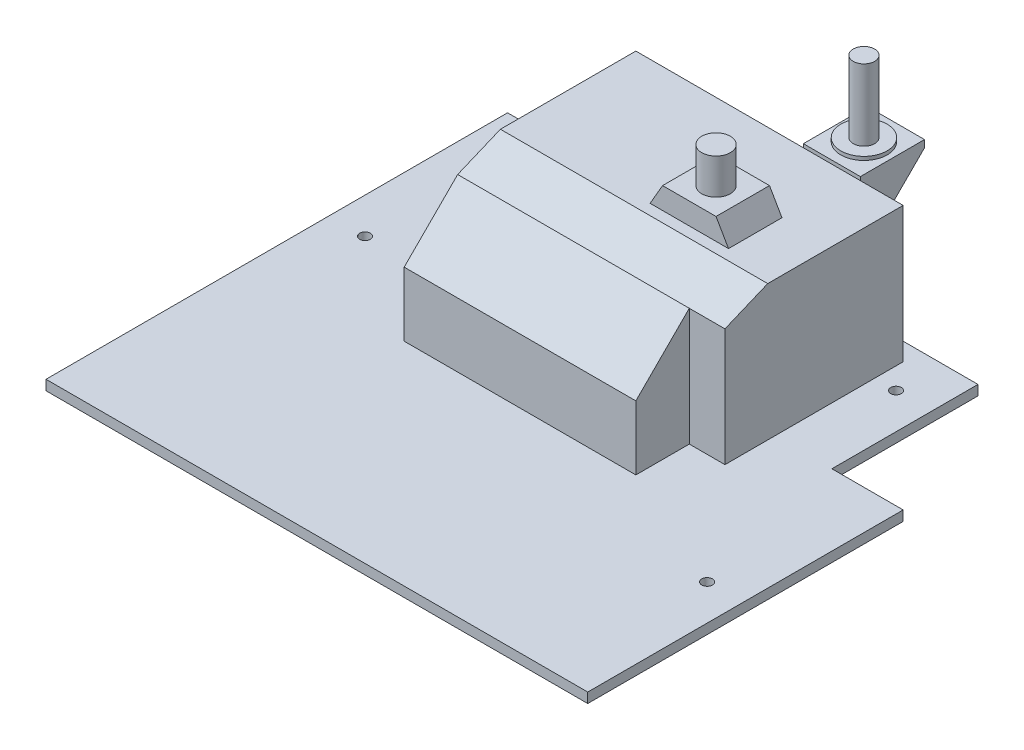
from build123d import *

# Parameters (mm, degrees)
SKETCH1_R           = 1.5
BOSS_EXTRUDE1_DEPTH = 2.8
BOSS_EXTRUDE2_DEPTH = 38
CUT_EXTRUDE1_REACH  = 136.827
SKETCH4_W           = 16
SKETCH4_H           = 20
BOSS_EXTRUDE3_DEPTH = 18
CHAMFER1_SIZE       = 18
SKETCH5_R           = 6.5
BOSS_EXTRUDE4_DEPTH = 1
SKETCH6_R           = 3
BOSS_EXTRUDE5_DEPTH = 20
BOSS_EXTRUDE6_DEPTH = 15
SKETCH8_R           = 4
BOSS_EXTRUDE7_DEPTH = 10


with BuildPart() as part:
    # Sketch1 → Boss-Extrude1 (new body)
    with BuildSketch(Plane(origin=(0, 0, 0), x_dir=(1, 0, 0), z_dir=(0, 1, 0))):
        Polygon((56, 23.75), (56, 64.75), (-76, 64.75), (-76, -64.75), (76, -64.75), (76, 23.75), align=None)
        with Locations(Location((66, -21.25, 0), (0, 0, 270))):
            Circle(SKETCH1_R, mode=Mode.SUBTRACT)
        with Locations(Location((-66, 14.75, 0), (0, 0, 270))):
            Circle(SKETCH1_R, mode=Mode.SUBTRACT)
        with Locations(Location((-46, 51.75, 0), (0, 0, 270))):
            Circle(SKETCH1_R, mode=Mode.SUBTRACT)
        with Locations(Location((46, 51.75, 0), (0, 0, 270))):
            Circle(SKETCH1_R, mode=Mode.SUBTRACT)
    extrude(amount=BOSS_EXTRUDE1_DEPTH)

    # Sketch2 → Boss-Extrude2 (add)
    with BuildSketch(Plane(origin=(0, 2.8, 0), x_dir=(1, 0, 0), z_dir=(0, 1, 0))):
        Polygon((-35, 59.75), (-35, -5.25), (30, -5.25), (30, 9.75), (40, 9.75), (40, 59.75), align=None)
    extrude(amount=BOSS_EXTRUDE2_DEPTH)

    # Sketch3 → Cut-Extrude1 (cut, up to next)
    with BuildSketch(Plane.ZY.offset(35), mode=Mode.PRIVATE) as cut_extrude1_sk1:
        Polygon((5.25, 20.8), (-9.75, 35.8), (-21.75, 40.8), (5.25, 40.8), align=None)
    cut_extrude1_tool1 = extrude(cut_extrude1_sk1.sketch, amount=-CUT_EXTRUDE1_REACH, mode=Mode.PRIVATE) & part.part
    add(cut_extrude1_tool1.solids().sort_by_distance((-35, 34.535632, -2.543103))[0], mode=Mode.SUBTRACT)

    # Sketch4 → Boss-Extrude3 (add)
    with BuildSketch(Plane(origin=(0, 0, -59.75), x_dir=(-1, 0, 0), z_dir=(0, 0, -1))):
        with Locations((-20, 31.8)):
            Rectangle(SKETCH4_W, SKETCH4_H)
    extrude(amount=BOSS_EXTRUDE3_DEPTH)

    # Chamfer1
    chamfer1_edges = [part.edges().sort_by_distance(p)[0] for p in [
        (20, 21.8, -77.75),
    ]]
    chamfer(chamfer1_edges, length=CHAMFER1_SIZE - 0.0001)  # a hair under: the kernel refuses the full size

    # Sketch5 → Boss-Extrude4 (add)
    with BuildSketch(Plane(origin=(0, 41.8, 0), x_dir=(1, 0, 0), z_dir=(0, 1, 0))):
        with Locations(Location((20, 68.75, 0), (0, 0, 270))):
            Circle(SKETCH5_R)
    extrude(amount=BOSS_EXTRUDE4_DEPTH)

    # Sketch6 → Boss-Extrude5 (add)
    with BuildSketch(Plane(origin=(0, 42.8, 0), x_dir=(1, 0, 0), z_dir=(0, 1, 0))):
        with Locations(Location((20, 68.75, 0), (0, 0, 270))):
            Circle(SKETCH6_R)
    extrude(amount=BOSS_EXTRUDE5_DEPTH)

    # Sketch7 → Boss-Extrude6 (add)
    with BuildSketch(Plane.XY.offset(-24.75)):
        Polygon((26, 40.8), (4, 40.8), (7.5, 46.862177826), (22.5, 46.862177826), align=None)
    extrude(amount=-BOSS_EXTRUDE6_DEPTH)

    # Sketch8 → Boss-Extrude7 (add)
    with BuildSketch(Plane(origin=(0, 46.862177826, 0), x_dir=(1, 0, 0), z_dir=(0, 1, 0))):
        with Locations(Location((15, 32.25, 0), (0, 0, 270))):
            Circle(SKETCH8_R)
    extrude(amount=BOSS_EXTRUDE7_DEPTH)


solid = part.part
